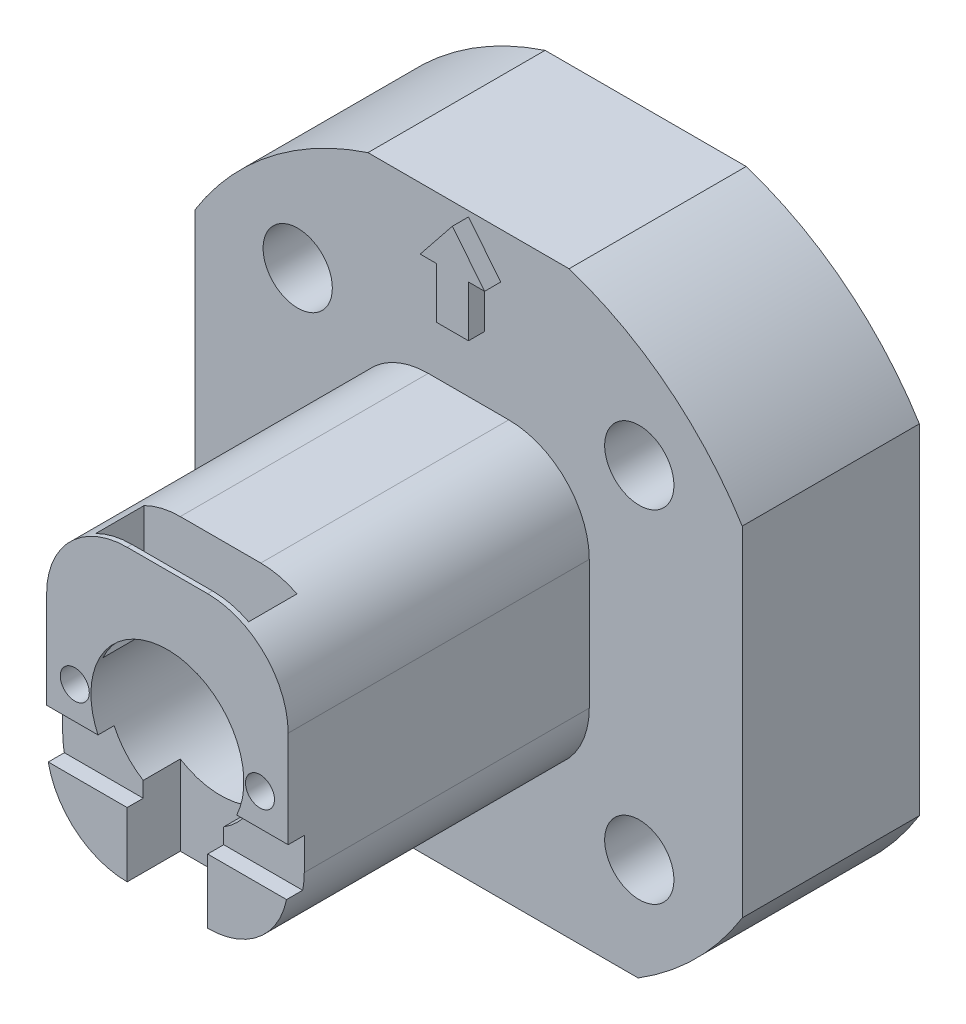
from build123d import *
from build123d.topology import SkipClean

# Parameters (mm, degrees)
SKETCH1_R           = 20
SKETCH1_R_2         = 4.75
BOSS_EXTRUDE1_DEPTH = 11
SKETCH2_W           = 13.186598354
SKETCH2_H           = 1
SKETCH2_W_2         = 3
SKETCH2_H_2         = 26.426474467
SKETCH2_H_3         = 26.621798467
SKETCH2_W_3         = 40.686040312
SKETCH2_H_4         = 3
CUT_EXTRUDE1_DEPTH  = 31.347981811
SKETCH3_R           = 2.15
CUT_EXTRUDE2_DEPTH  = 28.766886754
SKETCH5_R           = 0.9
BOSS_EXTRUDE2_DEPTH = 18.7
SKETCH13_R          = 0.9
BOSS_EXTRUDE3_DEPTH = 8.7
SKETCH7_W           = 68.268212127
SKETCH7_H           = 3
CUT_EXTRUDE4_DEPTH  = 1
SKETCH10_R          = 4.75
CUT_EXTRUDE6_DEPTH  = 40.141921261
SKETCH11_W          = 9.5
SKETCH11_H          = 3
CUT_EXTRUDE7_DEPTH  = 7
SKETCH12_R          = 6
CUT_EXTRUDE8_DEPTH  = 14.7
CHAMFER2_SIZE       = 1.5
CHAMFER1_SIZE       = 4
CHAMFER1_SIZE2      = 4.76701437
FILLET2_R           = 10
SKETCH14_W          = 5
SKETCH14_H          = 3.3
CUT_EXTRUDE9_DEPTH  = 10
BOSS_EXTRUDE4_DEPTH = 1


with BuildPart() as part:
    # Sketch1 → Boss-Extrude1 (new body)
    with BuildSketch(Plane.XY):
        Circle(SKETCH1_R)
        Circle(SKETCH1_R_2, mode=Mode.SUBTRACT)
    extrude(amount=BOSS_EXTRUDE1_DEPTH)

    # Sketch2 → Cut-Extrude1 (cut, through all)
    with BuildSketch(Plane.XY.offset(11)):
        with Locations((0, 19.5)):
            Rectangle(SKETCH2_W, SKETCH2_H)
        with Locations((-18.5, 2.677583481)):
            Rectangle(SKETCH2_W_2, SKETCH2_H_2)
        with Locations((18.5, -1.585343055)):
            Rectangle(SKETCH2_W_2, SKETCH2_H_3)
        with Locations((1.398669187, -18.5)):
            Rectangle(SKETCH2_W_3, SKETCH2_H_4)
    extrude(amount=-CUT_EXTRUDE1_DEPTH, mode=Mode.SUBTRACT)

    # Sketch3 → Cut-Extrude2 (cut, through all)
    with BuildSketch(Plane.XY.offset(11)):
        with Locations((-10.606601718, -10.606601718)):
            Circle(SKETCH3_R)
        with Locations((-10.606601718, 10.606601718)):
            Circle(SKETCH3_R)
        with Locations((10.606601718, 10.606601718)):
            Circle(SKETCH3_R)
        with Locations((10.606601718, -10.606601718)):
            Circle(SKETCH3_R)
    extrude(amount=-CUT_EXTRUDE2_DEPTH, mode=Mode.SUBTRACT)

    # Sketch5 → Boss-Extrude2 (add)
    with BuildSketch(Plane.XY.offset(11)):
        with BuildLine():
            Line((7.5, -4), (7.5, 4))
            ThreePointArc((7.5, 4), (6.035533906, 7.535533906), (2.5, 9))
            Line((2.5, 9), (-2.5, 9))
            ThreePointArc((-2.5, 9), (-6.035533906, 7.535533906), (-7.5, 4))
            Line((-7.5, 4), (-7.5, -4))
            ThreePointArc((-7.5, -4), (-6.035533906, -7.535533906), (-2.5, -9))
            Line((-2.5, -9), (2.5, -9))
            ThreePointArc((2.5, -9), (6.035533906, -7.535533906), (7.5, -4))
        make_face()
        with Locations(Location((-5.75, 0, 0), (0, 0, 270))):
            Circle(SKETCH5_R, mode=Mode.SUBTRACT)
        with Locations(Location((5.75, 0, 0), (0, 0, 270))):
            Circle(SKETCH5_R, mode=Mode.SUBTRACT)
    extrude(amount=BOSS_EXTRUDE2_DEPTH)

    # Sketch13 → Boss-Extrude3 (add)
    with BuildSketch(Plane.XY.offset(11)):
        with Locations(Location((5.75, 0, 0), (0, 0, 270))):
            Circle(SKETCH13_R)
        with Locations(Location((-5.75, 0, 0), (0, 0, 270))):
            Circle(SKETCH13_R)
    extrude(amount=BOSS_EXTRUDE3_DEPTH)

    # Sketch7 → Cut-Extrude4 (cut)
    with BuildSketch(Plane.XY.offset(29.7)):
        with Locations((-6.527699882, -3.5)):
            Rectangle(SKETCH7_W, SKETCH7_H)
    extrude(amount=-CUT_EXTRUDE4_DEPTH, mode=Mode.SUBTRACT)

    # Sketch10 → Cut-Extrude6 (cut, through all)
    with SkipClean():  # the faces are left unmerged after this step: merging them gives an invalid solid
        with BuildSketch(Plane(origin=(0, 0, 0), x_dir=(-1, 0, 0), z_dir=(0, 0, -1))):
            with Locations(Location((0, 0, 0), (0, 0, 335.09893763))):
                Circle(SKETCH10_R)
        extrude(amount=-CUT_EXTRUDE6_DEPTH, mode=Mode.SUBTRACT)

    # Sketch11 → Cut-Extrude7 (cut)
    with SkipClean():  # the faces are left unmerged after this step: merging them gives an invalid solid
        with BuildSketch(Plane(origin=(0, 9, 0), x_dir=(1, 0, 0), z_dir=(0, 1, 0))):
            with Locations((0, -27.9)):
                Rectangle(SKETCH11_W, SKETCH11_H)
        extrude(amount=-CUT_EXTRUDE7_DEPTH, mode=Mode.SUBTRACT)

    # Sketch12 → Cut-Extrude8 (cut)
    with BuildSketch(Plane(origin=(0, 0, 0), x_dir=(-1, 0, 0), z_dir=(0, 0, -1))):
        Circle(SKETCH12_R)
    extrude(amount=-CUT_EXTRUDE8_DEPTH, mode=Mode.SUBTRACT)

    # Chamfer2
    # the kernel refuses this chamfer: 1.5 mm, written as the material it adds along each edge
    with BuildSketch(Plane(origin=(0, 0, 14.7), x_dir=(-1, 0, 0), z_dir=(0, -1, 0))) as chamfer2_piece_1_section:
        Polygon((6, CHAMFER2_SIZE), (6 - CHAMFER2_SIZE, 0), (6, 0), align=None)
    chamfer2_piece_1 = revolve(axis=Axis((0, 0, 14.7), (0, 0, -1)), mode=Mode.PRIVATE)
    chamfer2_piece_1 = chamfer2_piece_1 - Plane(origin=(0, 0, 14.7), x_dir=(-0.9070362073508065, -0.4210526315731381, 0), z_dir=(0, 0, -1)) * Cylinder(4.75, 24, mode=Mode.PRIVATE)
    add(chamfer2_piece_1)

    # Chamfer1
    chamfer1_edges = [part.edges().sort_by_distance(p)[0] for p in [
        (6, 0, 0),
    ]]
    chamfer1_side = [part.faces().sort_by_distance(p)[0] for p in [
        (16.504823264, 0, 0),
    ]]
    chamfer(chamfer1_edges, length=CHAMFER1_SIZE, length2=CHAMFER1_SIZE2, reference=chamfer1_side[0])

    # Fillet2
    # the kernel refuses this fillet: 10 mm, written as the material it adds along each edge
    with BuildSketch(Plane(origin=(4.75, 2, 29.4), x_dir=(-1, 0, 0), z_dir=(0, 0, -1)), Plane(origin=(-4.75, 2, 19.052989911), x_dir=(1, 0, 0), z_dir=(0, 0, 1))) as fillet2_piece_1:
        with BuildLine():
            CenterArc((10, 2.938804035), FILLET2_R, 180, 17.090413612)
            Line((0, 2.938804035), (-0.2, 2.938804035))
            Line((-0.2, 2.938804035), (-0.2, 0))
            Line((-0.2, 0), (0, -0.2))
            ThreePointArc((0, -0.2), (0.220789008, -0.2), (0.250409575, -0.058776081))
            Line((0.250409575, -0.058776081), (0.441578015, 0))
        make_face()
    extrude(amount=10.347010089)

    # Sketch14 → Cut-Extrude9 (cut)
    with BuildSketch(Plane.XZ.offset(9)):
        with Locations((0, 28.05)):
            Rectangle(SKETCH14_W, SKETCH14_H)
    extrude(amount=-CUT_EXTRUDE9_DEPTH, mode=Mode.SUBTRACT)

    # Sketch15 → Boss-Extrude4 (add)
    with BuildSketch(Plane.XY.offset(11)):
        Polygon((-1, 13.002035862), (1, 13.002035862), (1, 16.164200489), (2, 16.164200489), (0, 18.664200489), (-2, 16.164200489), (-1, 16.164200489), align=None)
    extrude(amount=BOSS_EXTRUDE4_DEPTH)


solid = part.part
